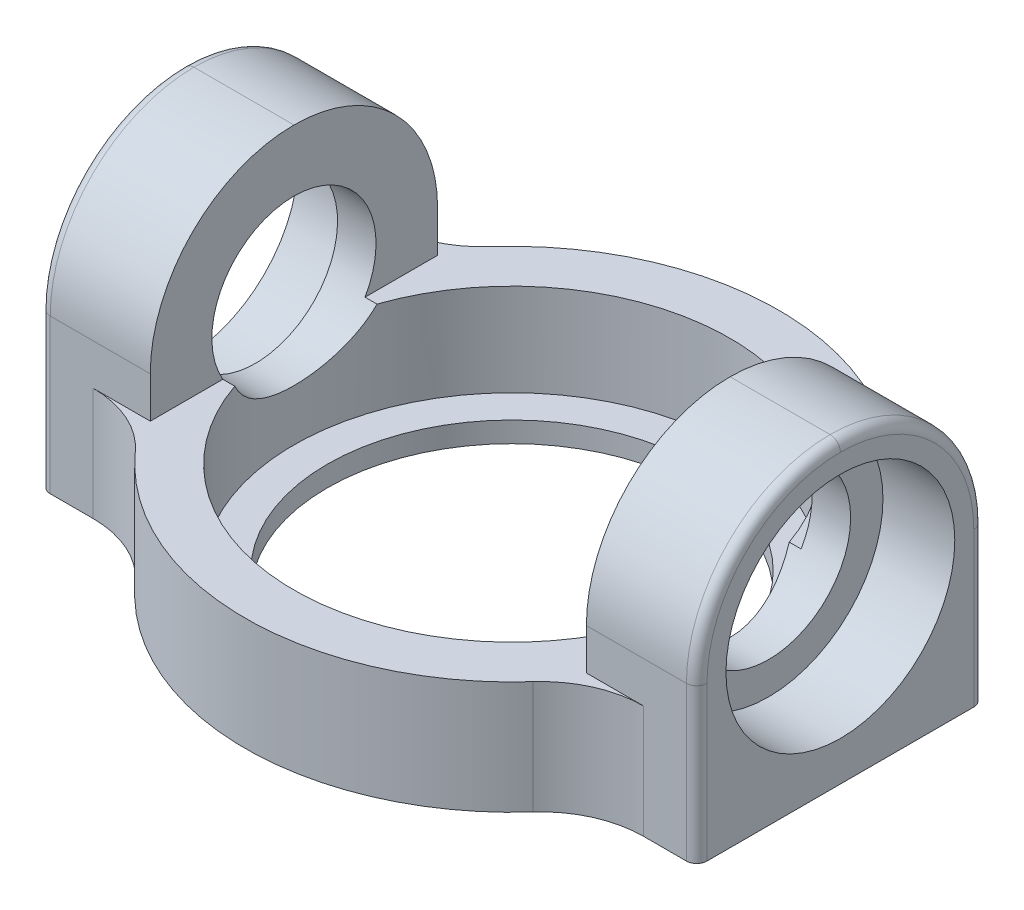
from build123d import *

# Parameters (mm, degrees)
SKETCH1_R                       = 26
SKETCH1_R_2                     = 21.25
BOSS_EXTRUDE1_DEPTH             = 9
BOSS_EXTRUDE2_START             = 2
SKETCH2_R                       = 26
SKETCH2_R_2                     = 18
BOSS_EXTRUDE2_DEPTH             = 2
BOSS_EXTRUDE3_REACH             = 40.38
SKETCH3_W                       = 10.75
SKETCH3_H                       = 28
BOSS_EXTRUDE3_DIRECTION_2_DEPTH = 18
SKETCH4_R                       = 11.15
CUT_EXTRUDE1_DEPTH              = 7
CUT_EXTRUDE2_START              = -7
SKETCH5_R                       = 11.15
CUT_EXTRUDE2_DEPTH              = 7
SKETCH6_R                       = 8
CUT_EXTRUDE3_DEPTH              = 69.220231603
FILLET2_R                       = 14
FILLET3_R                       = 10
FILLET4_R                       = 1


with BuildPart() as part:
    # Sketch1 → Boss-Extrude1 (new body)
    with BuildSketch(Plane(origin=(0, 0, 0), x_dir=(1, 0, 0), z_dir=(0, 1, 0))):
        with Locations(Location((0, 0, 0), (0, 0, 270))):
            Circle(SKETCH1_R)
        with Locations(Location((0, 0, 0), (0, 0, 270))):
            Circle(SKETCH1_R_2, mode=Mode.SUBTRACT)
    extrude(amount=BOSS_EXTRUDE1_DEPTH)

    # Sketch2 → Boss-Extrude2 (add)
    with BuildSketch(Plane.XZ.offset(BOSS_EXTRUDE2_START)):
        with Locations(Location((0, 0, 0), (0, 0, 270))):
            Circle(SKETCH2_R)
        with Locations(Location((0, 0, 0), (0, 0, 270))):
            Circle(SKETCH2_R_2, mode=Mode.SUBTRACT)
    extrude(amount=-BOSS_EXTRUDE2_DEPTH)

    # Boss-Extrude3: up to this face of the body (flat: up to its plane)
    boss_extrude3_end = Plane(part.part.faces().sort_by_distance((0, -2, 25.264608948))[0])
    # Sketch3 → Boss-Extrude3 (add, up to the picked face)
    with BuildSketch(Plane(origin=(0, 9, 0), x_dir=(1, 0, 0), z_dir=(0, 1, 0)), mode=Mode.PRIVATE) as boss_extrude3_sk1:
        with Locations((26.625, 0)):
            Rectangle(SKETCH3_W, SKETCH3_H)
    boss_extrude3_tool1 = split(extrude(boss_extrude3_sk1.sketch, amount=-BOSS_EXTRUDE3_REACH, mode=Mode.PRIVATE), bisect_by=boss_extrude3_end, keep=Keep.BOTH, mode=Mode.PRIVATE)
    # Sketch3 → Boss-Extrude3 (add, up to the picked face)
    with BuildSketch(Plane(origin=(0, 9, 0), x_dir=(1, 0, 0), z_dir=(0, 1, 0)), mode=Mode.PRIVATE) as boss_extrude3_sk2:
        with Locations((-26.625, 0)):
            Rectangle(SKETCH3_W, SKETCH3_H)
    boss_extrude3_tool2 = split(extrude(boss_extrude3_sk2.sketch, amount=-BOSS_EXTRUDE3_REACH, mode=Mode.PRIVATE), bisect_by=boss_extrude3_end, keep=Keep.BOTH, mode=Mode.PRIVATE)
    add(boss_extrude3_tool1.solids().sort_by(Axis((26.625, 9, 0), (0, -1, 0)))[0])
    add(boss_extrude3_tool2.solids().sort_by(Axis((-26.625, 9, 0), (0, -1, 0)))[0])

    # Sketch3 → Boss-Extrude3 direction 2 (add)
    with BuildSketch(Plane(origin=(0, 9, 0), x_dir=(1, 0, 0), z_dir=(0, 1, 0))):
        with Locations((26.625, 0)):
            Rectangle(SKETCH3_W, SKETCH3_H)
        with Locations((-26.625, 0)):
            Rectangle(SKETCH3_W, SKETCH3_H)
    extrude(amount=BOSS_EXTRUDE3_DIRECTION_2_DEPTH)

    # Sketch4 → Cut-Extrude1 (cut)
    with BuildSketch(Plane(origin=(32, 0, 0), x_dir=(0, 0, -1), z_dir=(1, 0, 0))):
        with Locations((0, 13)):
            Circle(SKETCH4_R)
    extrude(amount=-CUT_EXTRUDE1_DEPTH, mode=Mode.SUBTRACT)

    # Sketch5 → Cut-Extrude2 (cut)
    with BuildSketch(Plane.ZY.offset(32).offset(CUT_EXTRUDE2_START)):
        with Locations(Location((0, 13, 0), (0, 0, 180))):
            Circle(SKETCH5_R)
    extrude(amount=CUT_EXTRUDE2_DEPTH, mode=Mode.SUBTRACT)

    # Sketch6 → Cut-Extrude3 (cut, through all)
    with BuildSketch(Plane(origin=(25, 0, 0), x_dir=(0, 0, -1), z_dir=(1, 0, 0))):
        with Locations(Location((0, 13, 0), (0, 0, 330))):
            Circle(SKETCH6_R)
    extrude(amount=-CUT_EXTRUDE3_DEPTH, mode=Mode.SUBTRACT)

    # Fillet2
    fillet2_edges = [part.edges().sort_by_distance(p)[0] for p in [
        (-26.625, 27, 14),
        (-26.625, 27, -14),
        (26.625, 27, -14),
        (26.625, 27, 14),
    ]]
    fillet(fillet2_edges, radius=FILLET2_R - 0.0001)  # a hair under: the kernel refuses the full size

    # Fillet3
    fillet3_edges = [part.edges().sort_by_distance(p)[0] for p in [
        (-21.9089023, 3.5, -14),
        (-21.9089023, 3.5, 14),
        (21.9089023, 3.5, -14),
        (21.9089023, 3.5, 14),
    ]]
    fillet(fillet3_edges, radius=FILLET3_R)

    # Fillet4
    fillet4_edges = [part.edges().sort_by_distance(p)[0] for p in [
        (-32, 5.50005, 14),
        (-32, 5.50005, -14),
        (-32, 22.899524226, -9.899524226),
        (-32, 22.899524226, 9.899524226),
        (32, 5.50005, -14),
        (32, 5.50005, 14),
        (32, 22.899524226, 9.899524226),
        (32, 22.899524226, -9.899524226),
    ]]
    fillet(fillet4_edges, radius=FILLET4_R)


solid = part.part
